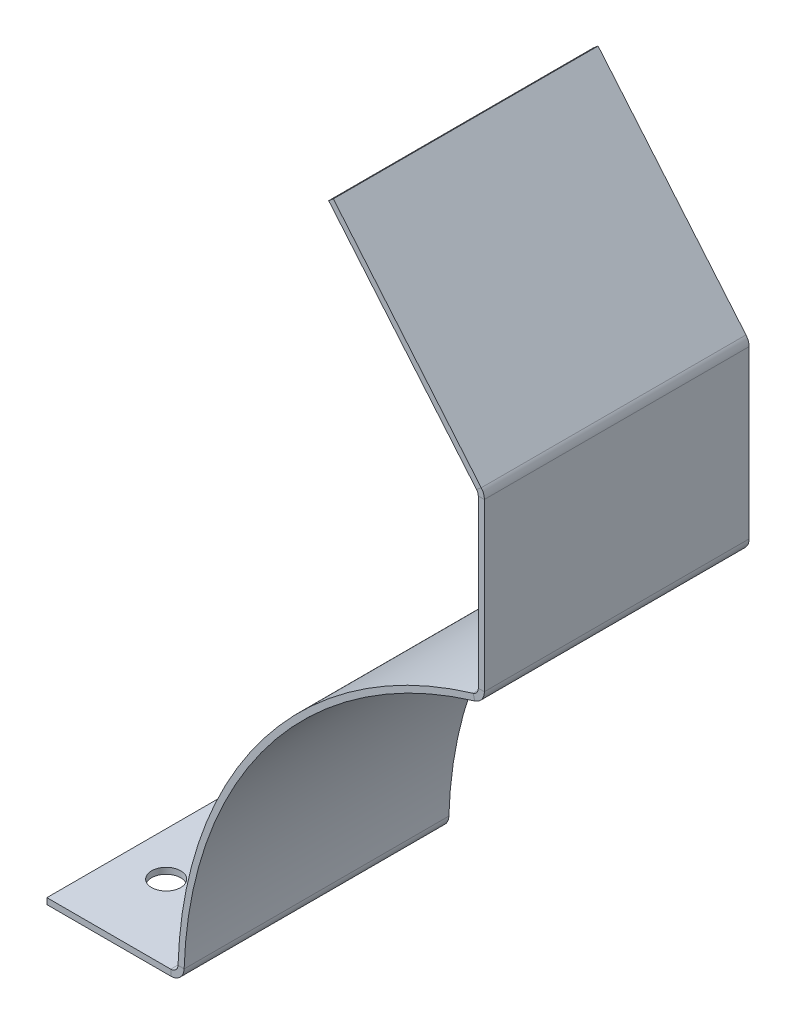
from build123d import *

# Parameters (mm, degrees)
BASE_FLANGE1_DEPTH           = 115.57
EDGE_FLANGE1_DEPTH           = 115.57
EDGE_FLANGE2_STRIP_CUT_DEPTH = 115.57
EDGE_FLANGE2_DEPTH           = 115.57
EDGE_FLANGE3_DEPTH           = 115.57
SKETCH20_R                   = 6.35
CUT_EXTRUDE1_DEPTH           = 2.65684


# Sheet-metal steps are written as plain solids
with BuildPart() as part:
    # Sketch1 → Base-Flange1 (new body)
    with BuildSketch(Plane.XY):
        with BuildLine():
            ThreePointArc((-50.8, 170.388379885), (-140.856418383, 108.500273734), (-177.710803869, 5.63118))
            Line((-177.710803869, 5.63118), (-180.366311024, 5.715325918))
            ThreePointArc((-180.366311024, 5.715325918), (-142.961215721, 110.121577824), (-51.559097143, 172.934469105))
            Line((-51.559097143, 172.934469105), (-50.8, 170.388379885))
        make_face()
    extrude(amount=BASE_FLANGE1_DEPTH)

    # Edge-Flange1 section (across the edge) → Edge-Flange1 (add)
    with BuildSketch(Plane(origin=(-49.291175996, 173.610632552, 115.57), x_dir=(-0.9999999996342678, -2.7045604981235094e-05, 0), z_dir=(0, 0, -1))):
        with BuildLine():
            Line((-2.65684, 2.366572064), (-2.65684, 76.2))
            Line((-2.65684, 76.2), (0, 76.2))
            Line((0, 76.2), (0, 2.366572064))
            ThreePointArc((0, 2.366572064), (0.62936233, 0.469112223), (2.267939433, -0.676102109))
            Line((2.267939433, -0.676102109), (1.508911151, -3.222211858))
            ThreePointArc((1.508911151, -3.222211858), (-1.500827273, -1.118682173), (-2.65684, 2.366572064))
        make_face()
    extrude(amount=EDGE_FLANGE1_DEPTH)

    # Edge-Flange2 strip (across the edge) → Edge-Flange2 strip cut (cut)
    with BuildSketch(Plane(origin=(-49.293236871, 249.810632524, 115.57), x_dir=(-0.766027058259036, -0.6428083275868535, 0), z_dir=(0, 0, -1))):
        Polygon((-12.205285278, 10.412383287), (-1.292448625, -2.593029), (0.742808893, -0.885245167), (-10.17002776, 12.12016712), align=None)
    extrude(amount=EDGE_FLANGE2_STRIP_CUT_DEPTH, mode=Mode.SUBTRACT)

    # Edge-Flange2 section (across the edge) → Edge-Flange2 (add)
    with BuildSketch(Plane(origin=(-49.293236871, 249.810632524, 115.57), x_dir=(-0.766027058259036, -0.6428083275868535, 0), z_dir=(0, 0, -1))):
        with BuildLine():
            Line((-2.65684, 1.155605494), (-2.65684, 101.6))
            Line((-2.65684, 101.6), (0, 101.6))
            Line((0, 101.6), (0, 1.155605494))
            ThreePointArc((0, 1.155605494), (0.191475929, 0.069691539), (0.742808893, -0.885245167))
            Line((0.742808893, -0.885245167), (-1.292448625, -2.593029))
            ThreePointArc((-1.292448625, -2.593029), (-2.305137014, -0.839001259), (-2.65684, 1.155605494))
        make_face()
    extrude(amount=EDGE_FLANGE2_DEPTH)

    # Edge-Flange3 section (across the edge) → Edge-Flange3 (add)
    with BuildSketch(Plane(origin=(-180.463740314, 2.640617339, 0), x_dir=(8.626632785422443e-05, 0.9999999962790604, 0), z_dir=(0, 0, 1))):
        with BuildLine():
            Line((-2.65684, 3.076251829), (-2.65684, 57.15))
            Line((-2.65684, 57.15), (0, 57.15))
            Line((0, 57.15), (0, 3.076251829))
            ThreePointArc((0, 3.076251829), (0.894756196, 0.86692768), (3.074716973, -0.097164046))
            Line((3.074716973, -0.097164046), (2.990800136, -2.75267845))
            ThreePointArc((2.990800136, -2.75267845), (-1.013351819, -0.981834768), (-2.65684, 3.076251829))
        make_face()
    extrude(amount=EDGE_FLANGE3_DEPTH)

    # Sketch20 → Cut-Extrude1 (cut)
    with BuildSketch(Plane(origin=(0.000226453, 2.625049375, 0), x_dir=(0.9999999962790604, -8.626632785420363e-05, 0), z_dir=(8.626632785420363e-05, 0.9999999962790604, 0))):
        with Locations(Location((-218.563967439, -31.75, 0), (0, 0, 180))):
            Circle(SKETCH20_R)
        with Locations(Location((-218.563967439, -82.55, 0), (0, 0, 180))):
            Circle(SKETCH20_R)
    extrude(amount=-CUT_EXTRUDE1_DEPTH, mode=Mode.SUBTRACT)


solid = part.part
